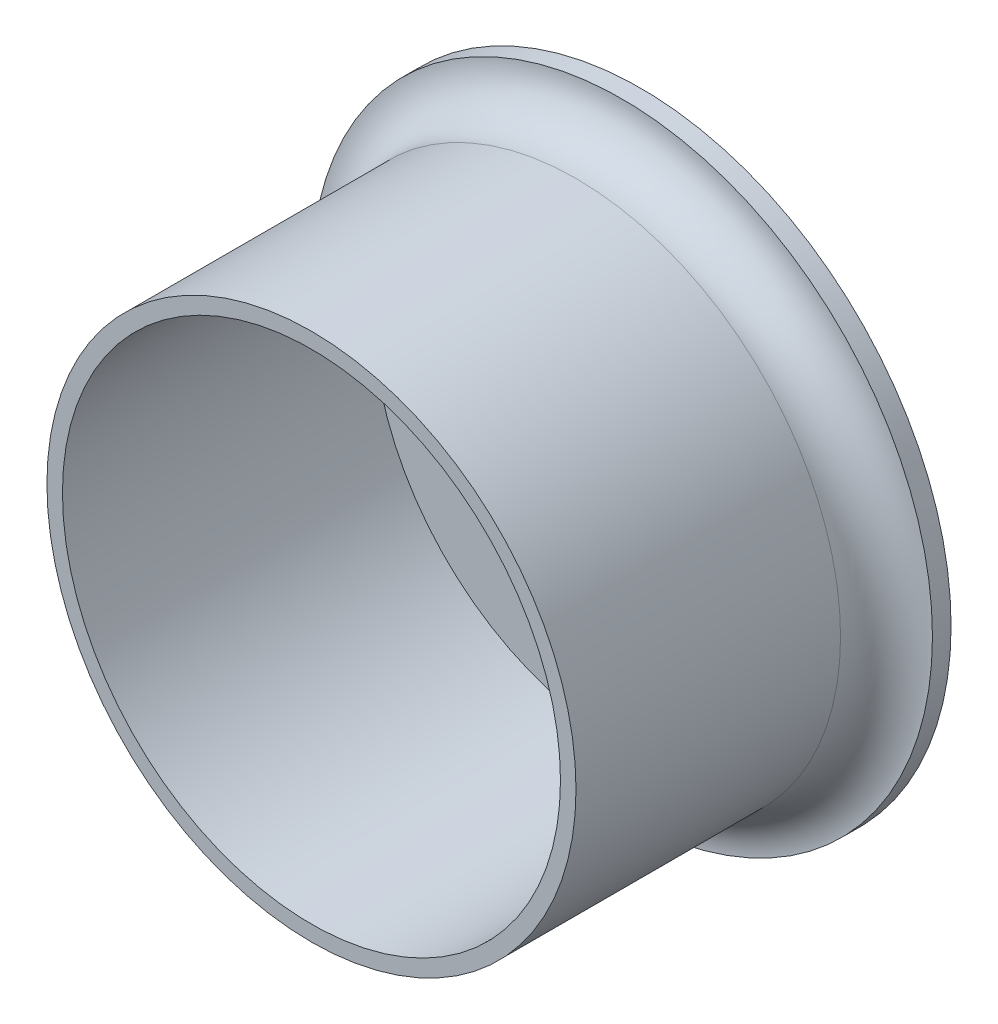
from build123d import *

# Parameters (mm, degrees)
SKETCH2_R           = 42.6
SKETCH2_R_2         = 40.1
BOSS_EXTRUDE2_DEPTH = 50
SKETCH3_R           = 50
BOSS_EXTRUDE3_DEPTH = 3
SKETCH4_R           = 45
SKETCH4_R_2         = 43
SKETCH4_R_3         = 35
SKETCH4_R_4         = 33
SKETCH4_R_5         = 25
SKETCH4_R_6         = 23
SKETCH4_R_7         = 15
SKETCH4_R_8         = 13
CUT_EXTRUDE1_DEPTH  = 1
FILLET1_R           = 1
FILLET2_R           = 7.4


with BuildPart() as part:
    # Sketch2 → Boss-Extrude2 (new body)
    with BuildSketch(Plane.XY):
        Circle(SKETCH2_R)
        Circle(SKETCH2_R_2, mode=Mode.SUBTRACT)
    extrude(amount=-BOSS_EXTRUDE2_DEPTH)

    # Sketch3 → Boss-Extrude3 (add)
    with BuildSketch(Plane(origin=(0, 0, -50), x_dir=(-1, 0, 0), z_dir=(0, 0, -1))):
        Circle(SKETCH3_R)
    extrude(amount=BOSS_EXTRUDE3_DEPTH)

    # Sketch4 → Cut-Extrude1 (cut)
    # profile 1 of 4: a face of its own
    with BuildSketch(Plane(origin=(0, 0, -53), x_dir=(-1, 0, 0), z_dir=(0, 0, -1))):
        Circle(SKETCH4_R)
        Circle(SKETCH4_R_2, mode=Mode.SUBTRACT)
    # profile 2 of 4: a face of its own
    with BuildSketch(Plane(origin=(0, 0, -53), x_dir=(-1, 0, 0), z_dir=(0, 0, -1))):
        Circle(SKETCH4_R_3)
        Circle(SKETCH4_R_4, mode=Mode.SUBTRACT)
    # profile 3 of 4: a face of its own
    with BuildSketch(Plane(origin=(0, 0, -53), x_dir=(-1, 0, 0), z_dir=(0, 0, -1))):
        Circle(SKETCH4_R_5)
        Circle(SKETCH4_R_6, mode=Mode.SUBTRACT)
    # profile 4 of 4: a face of its own
    with BuildSketch(Plane(origin=(0, 0, -53), x_dir=(-1, 0, 0), z_dir=(0, 0, -1))):
        Circle(SKETCH4_R_7)
        Circle(SKETCH4_R_8, mode=Mode.SUBTRACT)
    extrude(amount=-CUT_EXTRUDE1_DEPTH, mode=Mode.SUBTRACT)

    # Fillet1
    fillet1_edges = [part.edges().sort_by_distance(p)[0] for p in [
        (15, 0, -52),
        (13, 0, -52),
        (25, 0, -52),
        (23, 0, -52),
        (45, 0, -52),
        (43, 0, -52),
        (35, 0, -52),
        (33, 0, -52),
    ]]
    fillet(fillet1_edges, radius=FILLET1_R - 0.0001)  # a hair under: the kernel refuses the full size

    # Fillet2
    fillet2_edges = [part.edges().sort_by_distance(p)[0] for p in [
        (-42.6, 0, -50),
    ]]
    fillet(fillet2_edges, radius=FILLET2_R - 0.0001)  # a hair under: the kernel refuses the full size


solid = part.part
